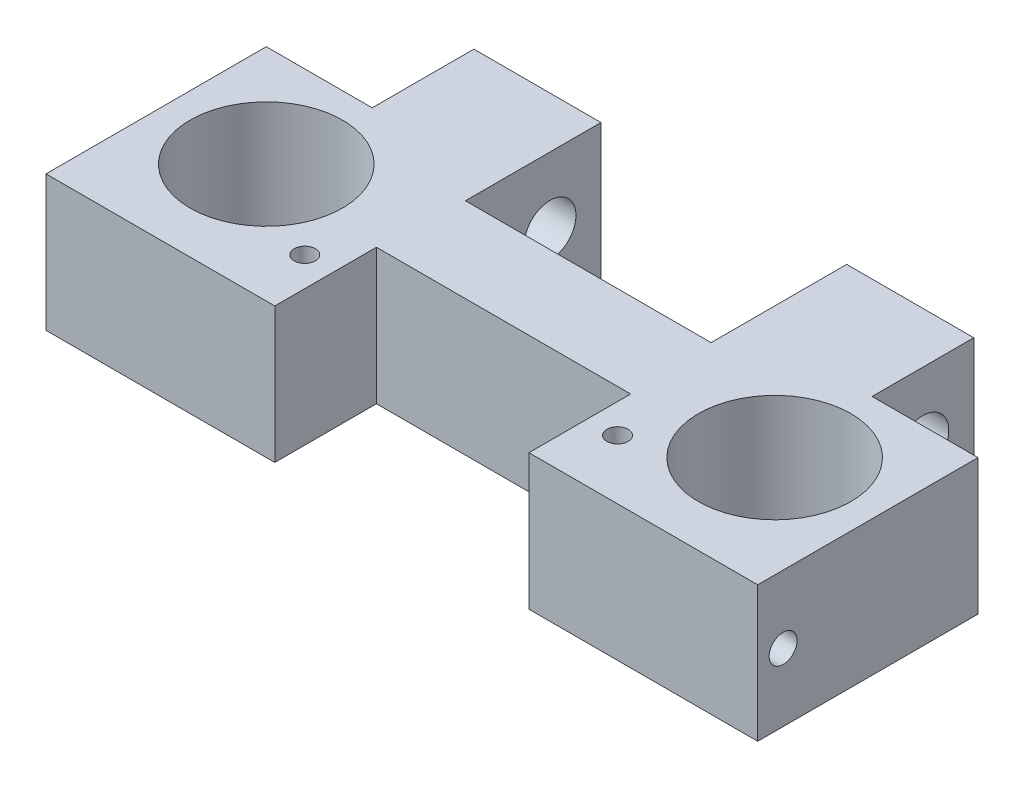
from build123d import *

# Parameters (mm, degrees)
SKETCH_1_R             = 9
EXTRUDE_1_DEPTH        = 8
SKETCH_7_R             = 3.05
CUT_EXTRUDE_1_DEPTH    = 77.165937269
CUT_EXTRUDE_2_REACH    = 53.43
SKETCH_10_W            = 30
SKETCH_10_H            = 12
HOLE_WIZARD_M3_1_D     = 2.5
HOLE_WIZARD_M3_1_DEPTH = 8.5
HOLE_WIZARD_M3_1_TIP   = 0.751075774


with BuildPart() as part:
    # 草图1 → 凸台-拉伸1 (new, symmetric)
    with BuildSketch(Plane(origin=(0, 0, 0), x_dir=(1, 0, 0), z_dir=(0, 1, 0))):
        Polygon((-42, -13), (42, -13), (42, 13), (29.5, 13), (29.5, 25), (14.5, 25), (14.5, 9), (-14.5, 9), (-14.5, 25), (-29.5, 25), (-29.5, 13), (-42, 13), align=None)
        with Locations((-30, 1)):
            Circle(SKETCH_1_R, mode=Mode.SUBTRACT)
        with Locations((30, 1)):
            Circle(SKETCH_1_R, mode=Mode.SUBTRACT)
    extrude(amount=EXTRUDE_1_DEPTH, both=True)

    # 草图7 → 切除-拉伸1 (cut, through all)
    with BuildSketch(Plane.ZY.offset(29.5)):
        with Locations((-19, 0)):
            Circle(SKETCH_7_R)
    extrude(amount=-CUT_EXTRUDE_1_DEPTH, mode=Mode.SUBTRACT)

    # 草图10 → 切除-拉伸2 (cut, up to next)
    with BuildSketch(Plane.XZ.offset(8), mode=Mode.PRIVATE) as cut_extrude_2_sk1:
        with Locations((0, 7)):
            Rectangle(SKETCH_10_W, SKETCH_10_H)
    cut_extrude_2_tool1 = extrude(cut_extrude_2_sk1.sketch, amount=-CUT_EXTRUDE_2_REACH, mode=Mode.PRIVATE) & part.part
    add(cut_extrude_2_tool1.solids().sort_by_distance((0, -8, 7))[0], mode=Mode.SUBTRACT)

    # 草图8 → M4 螺纹孔1 (revolve, cut)
    with BuildSketch(Plane(origin=(42, 0, 10), x_dir=(0, 0, -1), z_dir=(0, 1, 0))):
        Polygon((0, 0), (0, 10.491420021), (1.65, 9.5), (1.65, 0), align=None)
    hole_wizard_m4_1 = revolve(axis=Axis((48.35, 0, 10), (-1, 0, 0)), mode=Mode.SUBTRACT)

    # 镜向1: M4 螺纹孔1 across plane
    add(hole_wizard_m4_1.mirror(Plane(origin=(0, 0, 0), x_dir=(0, 0, 1), z_dir=(1, 0, 0))), mode=Mode.SUBTRACT)

    # M3 螺纹孔1
    with Locations(Plane(origin=(0, 8, 0), x_dir=(1, 0, 0), z_dir=(0, 1, 0))):
        with Locations((-18.456603619, -6), (18.456603619, -6)):
            Hole(HOLE_WIZARD_M3_1_D / 2, depth=HOLE_WIZARD_M3_1_DEPTH)
            with Locations((0, 0, -(HOLE_WIZARD_M3_1_DEPTH + HOLE_WIZARD_M3_1_TIP / 2))):  # 118° drill point
                Cone(0, HOLE_WIZARD_M3_1_D / 2, HOLE_WIZARD_M3_1_TIP, mode=Mode.SUBTRACT)


solid = part.part
